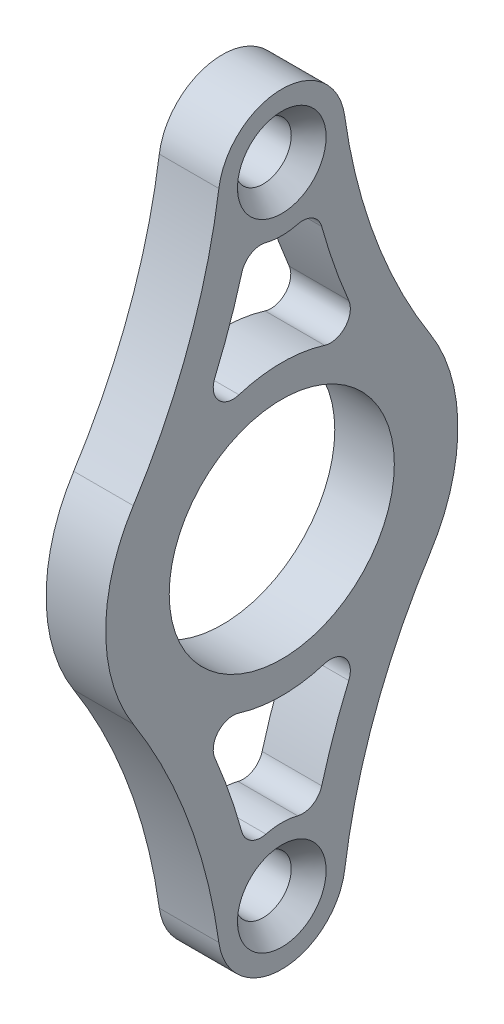
from build123d import *

# Parameters (mm, degrees)
SKETCH1_R                                      = 2.2479
SKETCH1_R_2                                    = 9.000000034
BOSS_EXTRUDE1_DEPTH                            = 4.7625
CUT_EXTRUDE1_DEPTH                             = 34.911033709
FILLET1_R                                      = 1.5875
CSK_FOR_6_FLAT_HEAD_MACHINE_SCREW1_D           = 4.3053
CSK_FOR_6_FLAT_HEAD_MACHINE_SCREW1_DEPTH       = 6.35
CSK_FOR_6_FLAT_HEAD_MACHINE_SCREW1_CSINK_D     = 7.0866
CSK_FOR_6_FLAT_HEAD_MACHINE_SCREW1_CSINK_ANGLE = 82
CSK_FOR_6_FLAT_HEAD_MACHINE_SCREW1_TIP         = 1.293442612


with BuildPart() as part:
    # Sketch1 → Boss-Extrude1 (new body)
    with BuildSketch(Plane.ZY.offset(-54.442)):
        with BuildLine():
            ThreePointArc((-11.872772186, 7.568598389), (-14.080000034, 0), (-11.872772186, -7.568598389))
            ThreePointArc((-11.872772186, -7.568598389), (-7.456309271, -16.470429165), (-5.030561789, -26.106999353))
            ThreePointArc((-5.030561789, -26.106999353), (0, -30.48), (5.030561789, -26.106999353))
            ThreePointArc((5.030561789, -26.106999353), (7.456309271, -16.470429165), (11.872772186, -7.568598389))
            ThreePointArc((11.872772186, -7.568598389), (14.080000034, 0), (11.872772186, 7.568598389))
            ThreePointArc((11.872772186, 7.568598389), (7.456309271, 16.470429165), (5.030561789, 26.106999353))
            ThreePointArc((5.030561789, 26.106999353), (0, 30.48), (-5.030561789, 26.106999353))
            ThreePointArc((-5.030561789, 26.106999353), (-7.456309271, 16.470429165), (-11.872772186, 7.568598389))
        make_face()
        with Locations((0, -25.4)):
            Circle(SKETCH1_R, mode=Mode.SUBTRACT)
        with Locations((0, 25.4)):
            Circle(SKETCH1_R, mode=Mode.SUBTRACT)
        Circle(SKETCH1_R_2, mode=Mode.SUBTRACT)
    extrude(amount=BOSS_EXTRUDE1_DEPTH)

    # Sketch2 → Cut-Extrude1 (cut, through all)
    with BuildSketch(Plane.ZY.offset(-49.6795)):
        with BuildLine():
            ThreePointArc((-2.74170389, 21.123382203), (-4.689517435, 14.807726344), (-7.45794489, 8.806285187))
            ThreePointArc((-7.45794489, 8.806285187), (0, 11.540000034), (7.45794489, 8.806285187))
            ThreePointArc((7.45794489, 8.806285187), (4.689517435, 14.807726344), (2.74170389, 21.123382203))
            ThreePointArc((2.74170389, 21.123382203), (0, 20.32), (-2.74170389, 21.123382203))
        make_face()
        with BuildLine():
            ThreePointArc((7.45794489, -8.806285187), (0, -11.540000034), (-7.45794489, -8.806285187))
            ThreePointArc((-7.45794489, -8.806285187), (-4.689517435, -14.807726344), (-2.74170389, -21.123382203))
            ThreePointArc((-2.74170389, -21.123382203), (0, -20.32), (2.74170389, -21.123382203))
            ThreePointArc((2.74170389, -21.123382203), (4.689517435, -14.807726344), (7.45794489, -8.806285187))
        make_face()
    extrude(amount=-CUT_EXTRUDE1_DEPTH, mode=Mode.SUBTRACT)

    # Fillet1
    fillet1_edges = [part.edges().sort_by_distance(p)[0] for p in [
        (52.06075, 8.806285187, 7.45794489),
        (52.06075, 8.806285187, -7.45794489),
        (52.06075, 21.123382203, 2.74170389),
        (52.06075, -8.806285187, -7.45794489),
        (52.06075, -8.806285187, 7.45794489),
        (52.06075, -21.123382203, 2.74170389),
        (52.06075, -21.123382203, -2.74170389),
        (52.06075, 21.123382203, -2.74170389),
    ]]
    fillet(fillet1_edges, radius=FILLET1_R)

    # CSK for #6 Flat Head Machine Screw1
    with Locations(Plane(origin=(54.442, 0, 0), x_dir=(0, 0, 1), z_dir=(1, 0, 0))):
        with Locations((0, -25.4), (0, 25.4)):
            CounterSinkHole(CSK_FOR_6_FLAT_HEAD_MACHINE_SCREW1_D / 2, CSK_FOR_6_FLAT_HEAD_MACHINE_SCREW1_CSINK_D / 2, depth=CSK_FOR_6_FLAT_HEAD_MACHINE_SCREW1_DEPTH, counter_sink_angle=CSK_FOR_6_FLAT_HEAD_MACHINE_SCREW1_CSINK_ANGLE)
            with Locations((0, 0, -(CSK_FOR_6_FLAT_HEAD_MACHINE_SCREW1_DEPTH + CSK_FOR_6_FLAT_HEAD_MACHINE_SCREW1_TIP / 2))):  # 118° drill point
                Cone(0, CSK_FOR_6_FLAT_HEAD_MACHINE_SCREW1_D / 2, CSK_FOR_6_FLAT_HEAD_MACHINE_SCREW1_TIP, mode=Mode.SUBTRACT)


solid = part.part
